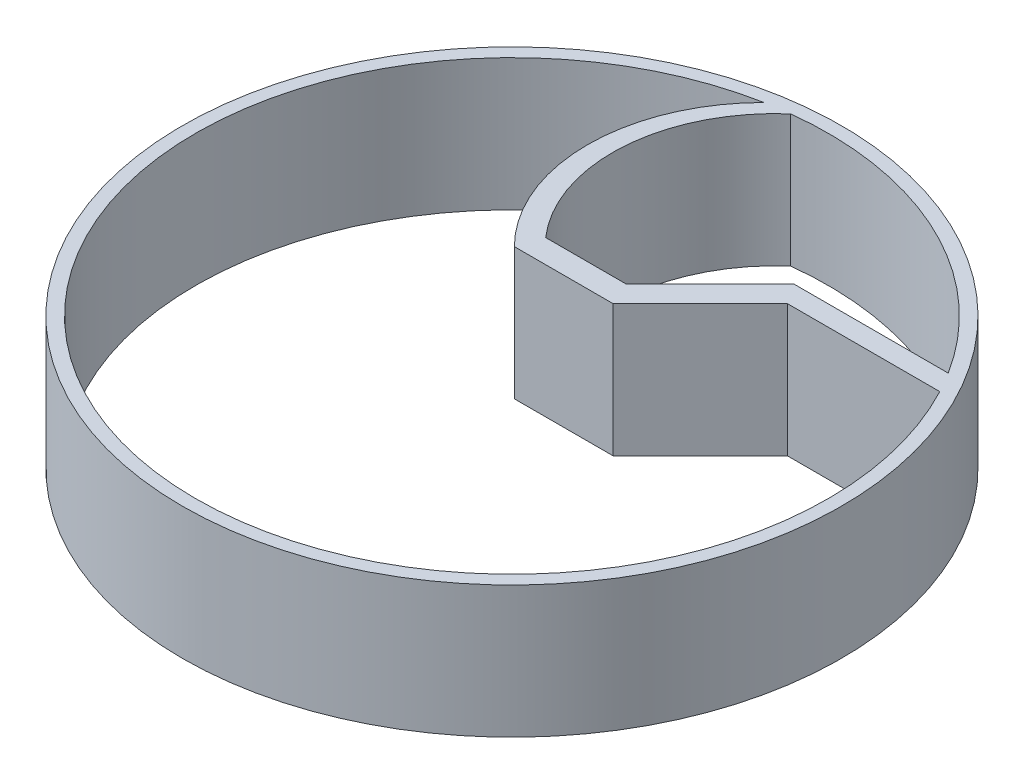
from build123d import *

# Parameters (mm, degrees)
SKETCH1_R           = 2.5
SKETCH1_R_2         = 2.4
BOSS_EXTRUDE1_DEPTH = 1
BOSS_EXTRUDE2_DEPTH = 1
SCALE1_SCALE        = 6


with BuildPart() as part:
    # Sketch1 → Boss-Extrude1 (new body)
    with BuildSketch(Plane(origin=(0, 0, 0), x_dir=(1, 0, 0), z_dir=(0, 1, 0))):
        Circle(SKETCH1_R)
        Circle(SKETCH1_R_2, mode=Mode.SUBTRACT)
    extrude(amount=BOSS_EXTRUDE1_DEPTH)

    # Sketch2 → Boss-Extrude2 (add)
    with BuildSketch(Plane(origin=(0, 0, 0), x_dir=(1, 0, 0), z_dir=(0, 1, 0))):
        with BuildLine():
            Line((2.119648162, 1.125651664), (0.964151756, 1.125651664))
            Line((0.964151756, 1.125651664), (0.302943091, 0.464443))
            Line((0.302943091, 0.464443), (-0.446002173, 0.464443))
            ThreePointArc((-0.446002173, 0.464443), (-0.838210984, 1.411318831), (-0.446002173, 2.358194662))
            ThreePointArc((-0.446002173, 2.358194662), (-0.358295432, 2.373104377), (-0.27009636, 2.384753228))
            ThreePointArc((-0.27009636, 2.384753228), (-0.689298485, 1.537997556), (-0.386972473, 0.642830213))
            Line((-0.386972473, 0.642830213), (0.22293871, 0.642830213))
            Line((0.22293871, 0.642830213), (0.859210068, 1.279101571))
            Line((0.859210068, 1.279101571), (2.030738577, 1.279101571))
            ThreePointArc((2.030738577, 1.279101571), (2.07661124, 1.203198138), (2.119648162, 1.125651664))
        make_face()
    extrude(amount=BOSS_EXTRUDE2_DEPTH)


with BuildPart() as part_1:
    # Scale1: scaled about (0.075697156, 0.5, -0.360299867)
    add(part.part.scale(SCALE1_SCALE).moved(Location((-0.37848578, -2.5, 1.801499335))))


solid = part_1.part
